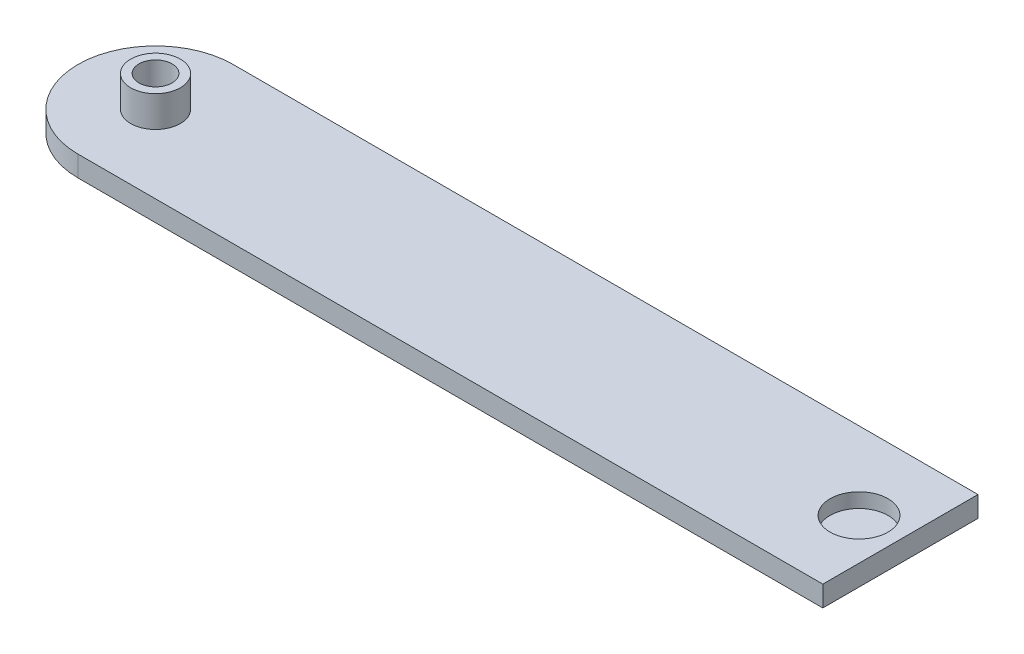
from build123d import *

# Parameters (mm, degrees)
BOSS_EXTRUDE1_DEPTH = 2
SKETCH2_R           = 1.6
CUT_EXTRUDE1_DEPTH  = 1.8
SKETCH3_R           = 0.8
CUT_EXTRUDE2_DEPTH  = 3
SKETCH4_R           = 2.8
CUT_EXTRUDE3_DEPTH  = 1.4
BOSS_EXTRUDE2_START = 3
SKETCH5_R           = 2.4
SKETCH5_R_2         = 1.6
BOSS_EXTRUDE2_DEPTH = 3


with BuildPart() as part:
    # Sketch1 → Boss-Extrude1 (new body)
    with BuildSketch(Plane(origin=(0, 0, 0), x_dir=(1, 0, 0), z_dir=(0, 1, 0))):
        with BuildLine():
            Line((72, 7.5), (0, 7.5))
            ThreePointArc((0, 7.5), (-7.5, 0), (0, -7.5))
            Line((0, -7.5), (72, -7.5))
            Line((72, -7.5), (72, 7.5))
        make_face()
    extrude(amount=BOSS_EXTRUDE1_DEPTH)

    # Sketch2 → Cut-Extrude1 (cut)
    with BuildSketch(Plane(origin=(0, 2, 0), x_dir=(1, 0, 0), z_dir=(0, 1, 0))):
        Circle(SKETCH2_R)
    extrude(amount=-CUT_EXTRUDE1_DEPTH, mode=Mode.SUBTRACT)

    # Sketch3 → Cut-Extrude2 (cut)
    with BuildSketch(Plane(origin=(0, 0.2, 0), x_dir=(1, 0, 0), z_dir=(0, 1, 0))):
        Circle(SKETCH3_R)
    extrude(amount=-CUT_EXTRUDE2_DEPTH, mode=Mode.SUBTRACT)

    # Sketch4 → Cut-Extrude3 (cut)
    with BuildSketch(Plane(origin=(0, 2, 0), x_dir=(1, 0, 0), z_dir=(0, 1, 0))):
        with Locations((68, 0)):
            Circle(SKETCH4_R)
    extrude(amount=-CUT_EXTRUDE3_DEPTH, mode=Mode.SUBTRACT)

    # Sketch5 → Boss-Extrude2 (add)
    with BuildSketch(Plane(origin=(0, 2, 0), x_dir=(1, 0, 0), z_dir=(0, 1, 0)).offset(BOSS_EXTRUDE2_START)):
        Circle(SKETCH5_R)
        Circle(SKETCH5_R_2, mode=Mode.SUBTRACT)
    extrude(amount=-BOSS_EXTRUDE2_DEPTH)


solid = part.part
